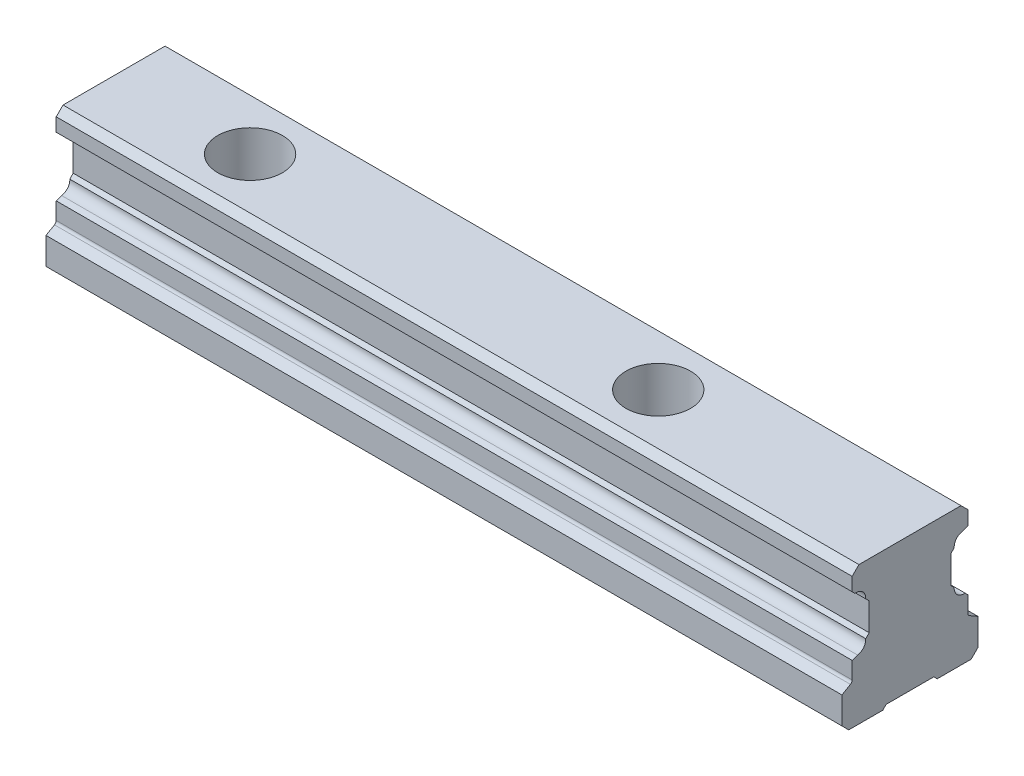
from build123d import *

# Parameters (mm, degrees)
BOSS_EXTRUDE1_DEPTH = 117
SKETCH2_W           = 117
SKETCH2_H           = 5.816025404
BOSS_EXTRUDE2_DEPTH = 1.5
SKETCH3_W           = 117
SKETCH3_H           = 4.95
BOSS_EXTRUDE3_DEPTH = 1.5
SKETCH4_W           = 7
SKETCH4_H           = 0.5
CUT_EXTRUDE1_DEPTH  = 120.168326329
DRAFT1_ANGLE        = 30
DRAFT2_ANGLE        = 30
DRAFT3_ANGLE        = 45
HOLE1_D             = 6
HOLE1_DEPTH         = 20.3
HOLE1_CBORE_D       = 9.5
HOLE1_CBORE_DEPTH   = 8.5
CHAMFER1_SIZE       = 1
CHAMFER2_SIZE       = 0.404011753
CHAMFER2_SIZE_2     = 0.538175706
FILLET1_R           = 0.5


with BuildPart() as part:
    # Sketch1 → Boss-Extrude1 (new body)
    with BuildSketch(Plane(origin=(58.5, 0, 0), x_dir=(0, 0, -1), z_dir=(1, 0, 0))):
        with BuildLine():
            Line((-8.5, 0), (8.5, 0))
            Line((8.5, 0), (8.5, 9.005088936))
            ThreePointArc((8.5, 9.005088936), (7.111244718, 9.113338811), (6.503340774, 10.366659226))
            Line((6.503340774, 10.366659226), (6, 10.87))
            Line((6, 10.87), (6, 14.93))
            Line((6, 14.93), (6.503340774, 15.433340774))
            ThreePointArc((6.503340774, 15.433340774), (7.111244718, 16.686661189), (8.5, 16.794911064))
            Line((8.5, 16.794911064), (8.5, 20.3))
            Line((8.5, 20.3), (-8.5, 20.3))
            Line((-8.5, 20.3), (-8.5, 16.794911064))
            ThreePointArc((-8.5, 16.794911064), (-7.111244718, 16.686661189), (-6.503340774, 15.433340774))
            Line((-6.503340774, 15.433340774), (-6, 14.93))
            Line((-6, 14.93), (-6, 10.87))
            Line((-6, 10.87), (-6.503340774, 10.366659226))
            ThreePointArc((-6.503340774, 10.366659226), (-7.111244718, 9.113338811), (-8.5, 9.005088936))
            Line((-8.5, 9.005088936), (-8.5, 0))
        make_face()
    extrude(amount=-BOSS_EXTRUDE1_DEPTH)

    # Sketch2 → Boss-Extrude2 (add)
    with BuildSketch(Plane(origin=(0, 0, -8.5), x_dir=(-1, 0, 0), z_dir=(0, 0, -1))):
        with Locations((0, 2.908012702)):
            Rectangle(SKETCH2_W, SKETCH2_H)
    extrude(amount=BOSS_EXTRUDE2_DEPTH)

    # Sketch3 → Boss-Extrude3 (add)
    with BuildSketch(Plane.XY.offset(8.5)):
        with Locations((0, 2.475)):
            Rectangle(SKETCH3_W, SKETCH3_H)
    extrude(amount=BOSS_EXTRUDE3_DEPTH)

    # Sketch4 → Cut-Extrude1 (cut, through all)
    with BuildSketch(Plane.ZY.offset(58.5)):
        with Locations((0, 0.25)):
            Rectangle(SKETCH4_W, SKETCH4_H)
    extrude(amount=-CUT_EXTRUDE1_DEPTH, mode=Mode.SUBTRACT)

    # Draft1
    draft1_faces = [part.faces().sort_by_distance(p)[0] for p in [
        (0, 4.95, 9.25),
    ]]
    draft(draft1_faces, Plane.XY.offset(10), DRAFT1_ANGLE)

    # Draft2
    draft2_faces = [part.faces().sort_by_distance(p)[0] for p in [
        (0, 5.816025404, -9.25),
    ]]
    draft(draft2_faces, Plane(origin=(-58.5, 0, -8.5), x_dir=(0, -1, 0), z_dir=(0, 0, -1)), DRAFT2_ANGLE)

    # Draft3
    draft3_faces = [part.faces().sort_by_distance(p)[0] for p in [
        (0, 0.25, 3.5),
        (0, 0.25, -3.5),
    ]]
    draft(draft3_faces, Plane(origin=(58.5, 0.5, 3.5), x_dir=(0, 0, -1), z_dir=(0, -1, 0)), DRAFT3_ANGLE)

    # Hole1
    with Locations(Plane(origin=(0, 20.3, 0), x_dir=(-1, 0, 0), z_dir=(0, 1, 0))):
        with Locations((38.5, 0), (-21.5, 0)):
            CounterBoreHole(HOLE1_D / 2, HOLE1_CBORE_D / 2, HOLE1_CBORE_DEPTH, depth=HOLE1_DEPTH)

    # Chamfer1
    chamfer1_edges = [part.edges().sort_by_distance(p)[0] for p in [
        (0, 20.3, 8.5),
        (0, 20.3, -8.5),
        (0, 0, -10),
        (0, 0, 10),
    ]]
    chamfer(chamfer1_edges, length=CHAMFER1_SIZE)

    # Chamfer2
    # the kernel refuses this chamfer: 0.538175706, 0.404011753 mm, written as the material it takes off along each edge
    with BuildSketch(Plane(origin=(60.548293872, 9.005088936, 8.5), x_dir=(0, -0.15244489299056474, -0.9883119723048464), z_dir=(-1, 0, 0))) as chamfer2_piece_1:
        with BuildLine():
            Line((0.800315903, 0), (CHAMFER2_SIZE * 0.152444893097, CHAMFER2_SIZE * 0.988311972993))
            Line((CHAMFER2_SIZE * 0.152444893097, CHAMFER2_SIZE * 0.988311972993), (0, 0))
            ThreePointArc((0, 0), (0.41007662, 0.05837118), (0.800315903, 0))
        make_face()
    extrude(amount=121.096587744, mode=Mode.SUBTRACT)
    with BuildSketch(Plane(origin=(59.884017308, 16.794911064, 8.5), x_dir=(0, 1, 0), z_dir=(-1, 0, 0))) as chamfer2_piece_2:
        with BuildLine():
            Line((CHAMFER2_SIZE_2, 0), (0.122854653, 0.415321053))
            ThreePointArc((0.122854653, 0.415321053), (0.079061625, 0.207906373), (0, 0))
            Line((0, 0), (CHAMFER2_SIZE_2, 0))
        make_face()
    extrude(amount=119.768034616, mode=Mode.SUBTRACT)
    with BuildSketch(Plane(origin=(60.548293872, 16.794911064, -8.5), x_dir=(0, 1, 0), z_dir=(-1, 0, 0))) as chamfer2_piece_3:
        with BuildLine():
            Line((CHAMFER2_SIZE, 0), (0.122004072, -0.790961789))
            ThreePointArc((0.122004072, -0.790961789), (0.120203022, -0.396385245), (0, 0))
            Line((0, 0), (CHAMFER2_SIZE, 0))
        make_face()
    extrude(amount=121.096587744, mode=Mode.SUBTRACT)
    with BuildSketch(Plane(origin=(59.884017308, 9.005088936, -8.5), x_dir=(0, -0.28365649946208477, 0.958925956637381), z_dir=(-1, 0, 0))) as chamfer2_piece_4:
        with BuildLine():
            Line((0.433110659, 0), (CHAMFER2_SIZE_2 * 0.283656499578, -CHAMFER2_SIZE_2 * 0.958925957029))
            Line((CHAMFER2_SIZE_2 * 0.283656499578, -CHAMFER2_SIZE_2 * 0.958925957029), (0, 0))
            ThreePointArc((0, 0), (0.221793162, -0.01684025), (0.433110659, 0))
        make_face()
    extrude(amount=119.768034616, mode=Mode.SUBTRACT)

    # Fillet1
    fillet1_edges = [part.edges().sort_by_distance(p)[0] for p in [
        (0, 5.816025404, -8.5),
        (0, 5.816025404, 8.5),
    ]]
    fillet(fillet1_edges, radius=FILLET1_R)


solid = part.part
